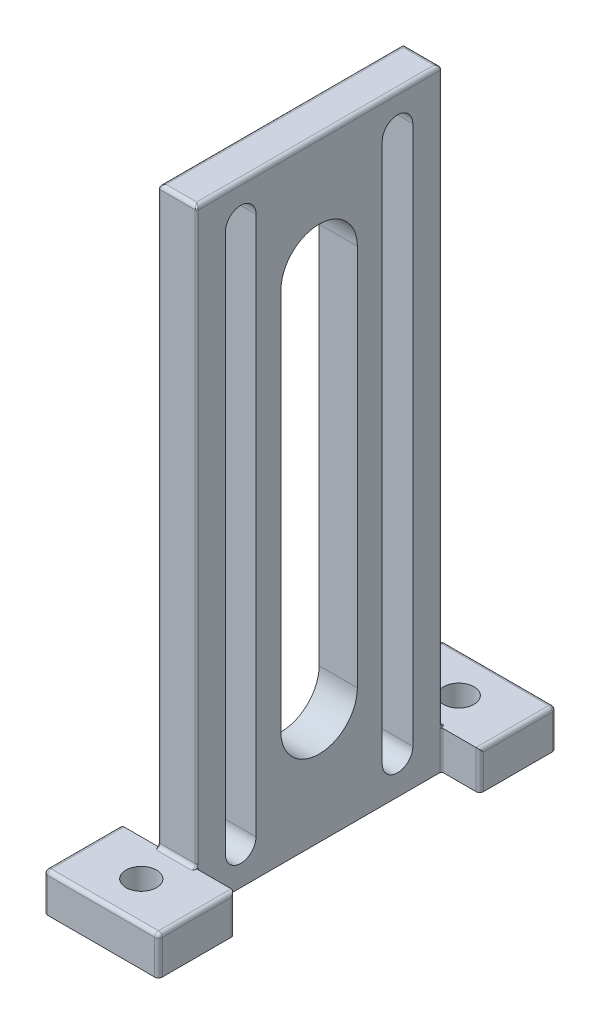
from build123d import *

# Parameters (mm, degrees)
SKETCH1_W             = 32
SKETCH1_H             = 80
BOSS_EXTRUDE1_DEPTH   = 2.5
CUT_EXTRUDE1_REACH    = 45.37
CUT_EXTRUDE2_REACH    = 45.37
SKETCH4_W             = 10
SKETCH4_H             = 15
BOSS_EXTRUDE2_DEPTH   = 5
FILLET1_R             = 0.5
FILLET2_R             = 0.2
CUT_EXTRUDE3_REACH    = 81.732
SKETCH5_R             = 2
BODY_MOVE_COPY1_ANGLE = 90


with BuildPart() as part:
    # Sketch1 → Boss-Extrude1 (new, symmetric)
    with BuildSketch(Plane.XY):
        Rectangle(SKETCH1_W, SKETCH1_H)
    extrude(amount=BOSS_EXTRUDE1_DEPTH, both=True)

    # Sketch2 → Cut-Extrude1 (cut, up to next)
    with BuildSketch(Plane.XY.offset(2.5), mode=Mode.PRIVATE) as cut_extrude1_sk1:
        with BuildLine():
            Line((-5, 25), (-5, -25))
            ThreePointArc((-5, -25), (0, -30), (5, -25))
            Line((5, -25), (5, 25))
            ThreePointArc((5, 25), (0, 30), (-5, 25))
        make_face()
    cut_extrude1_tool1 = extrude(cut_extrude1_sk1.sketch, amount=-CUT_EXTRUDE1_REACH, mode=Mode.PRIVATE) & part.part
    add(cut_extrude1_tool1.solids().sort_by_distance((0, 0, 2.5))[0], mode=Mode.SUBTRACT)

    # Sketch3 → Cut-Extrude2 (cut, up to next)
    with BuildSketch(Plane.XY.offset(2.5), mode=Mode.PRIVATE) as cut_extrude2_sk1:
        with BuildLine():
            Line((-12.25, 35.25), (-12.25, -35.25))
            ThreePointArc((-12.25, -35.25), (-10.25, -37.25), (-8.25, -35.25))
            Line((-8.25, -35.25), (-8.25, 35.25))
            ThreePointArc((-8.25, 35.25), (-10.25, 37.25), (-12.25, 35.25))
        make_face()
    cut_extrude2_tool1 = extrude(cut_extrude2_sk1.sketch, amount=-CUT_EXTRUDE2_REACH, mode=Mode.PRIVATE) & part.part
    cut_extrude2 = cut_extrude2_tool1.solids().sort_by_distance((-10.25, 0, 2.5))[0]
    add(cut_extrude2, mode=Mode.SUBTRACT)

    # Mirror1: Cut-Extrude2 across plane
    add(cut_extrude2.mirror(Plane(origin=(0, 0, 0), x_dir=(0, 0, 1), z_dir=(1, 0, 0))), mode=Mode.SUBTRACT)

    # Sketch4 → Boss-Extrude2 (add)
    with BuildSketch(Plane(origin=(0, -40, 0), x_dir=(-1, 0, 0), z_dir=(0, -1, 0))):
        with Locations((21, 0)):
            Rectangle(SKETCH4_W, SKETCH4_H)
        with Locations((-21, 0)):
            Rectangle(SKETCH4_W, SKETCH4_H)
    extrude(amount=-BOSS_EXTRUDE2_DEPTH)

    # Fillet1
    fillet1_edges = [part.edges().sort_by_distance(p)[0] for p in [
        (16, 40, 0),
        (0, 40, 2.5),
        (-16, 40, 0),
        (0, 40, -2.5),
        (-16, -37.5, 7.5),
        (16, -37.5, 7.5),
        (16, -37.5, -7.5),
        (-16, -37.5, -7.5),
        (-21, -35, 7.5),
        (-26, -37.5, 7.5),
        (-26, -35, 0),
        (-26, -37.5, -7.5),
        (-21, -35, -7.5),
        (21, -35, 7.5),
        (26, -37.5, 7.5),
        (26, -37.5, -7.5),
        (21, -35, -7.5),
        (26, -35, 0),
        (16, -35, 0),
        (-16, -35, 0),
    ]]
    fillet(fillet1_edges, radius=FILLET1_R)

    # Fillet2
    fillet2_edges = [part.edges().sort_by_distance(p)[0] for p in [
        (16, -37.5, -2.5),
    ]]
    fillet(fillet2_edges, radius=FILLET2_R)
    fillet2_2_edges = [part.edges().sort_by_distance(p)[0] for p in [
        (-16, 2.5, -2.5),
        (-16.146446609, -34.853553391, -2.5),
        (-15.853553391, 39.853553391, -2.353553391),
    ]]
    fillet(fillet2_2_edges, radius=FILLET2_R)
    fillet2_3_edges = [part.edges().sort_by_distance(p)[0] for p in [
        (16, 2.5, -2.5),
        (16.146446609, -34.853553391, -2.5),
        (15.853553391, 39.853553391, -2.353553391),
    ]]
    fillet(fillet2_3_edges, radius=FILLET2_R)
    fillet2_4_edges = [part.edges().sort_by_distance(p)[0] for p in [
        (-16, -37.5, -2.5),
    ]]
    fillet(fillet2_4_edges, radius=FILLET2_R)
    fillet2_5_edges = [part.edges().sort_by_distance(p)[0] for p in [
        (16, -37.5, 2.5),
    ]]
    fillet(fillet2_5_edges, radius=FILLET2_R)
    fillet2_6_edges = [part.edges().sort_by_distance(p)[0] for p in [
        (-16, 2.5, 2.5),
        (-16.146446609, -34.853553391, 2.5),
        (-15.853553391, 39.853553391, 2.353553391),
    ]]
    fillet(fillet2_6_edges, radius=FILLET2_R)
    fillet2_7_edges = [part.edges().sort_by_distance(p)[0] for p in [
        (16, 2.5, 2.5),
        (16.146446609, -34.853553391, 2.5),
        (15.853553391, 39.853553391, 2.353553391),
    ]]
    fillet(fillet2_7_edges, radius=FILLET2_R)
    fillet2_8_edges = [part.edges().sort_by_distance(p)[0] for p in [
        (-16, -37.5, 2.5),
    ]]
    fillet(fillet2_8_edges, radius=FILLET2_R)

    # Sketch5 → Cut-Extrude3 (cut, up to next)
    with BuildSketch(Plane(origin=(0, -35, 0), x_dir=(1, 0, 0), z_dir=(0, 1, 0)), mode=Mode.PRIVATE) as cut_extrude3_sk1:
        with Locations((20.75, 0)):
            Circle(SKETCH5_R)
    cut_extrude3_tool1 = extrude(cut_extrude3_sk1.sketch, amount=-CUT_EXTRUDE3_REACH, mode=Mode.PRIVATE) & part.part
    cut_extrude3 = cut_extrude3_tool1.solids().sort_by_distance((20.75, -35, 0))[0]
    add(cut_extrude3, mode=Mode.SUBTRACT)

    # Mirror2: Cut-Extrude3 across plane
    add(cut_extrude3.mirror(Plane(origin=(0, 0, 0), x_dir=(0, 0, 1), z_dir=(1, 0, 0))), mode=Mode.SUBTRACT)


with BuildPart() as part_1:
    # Body-Move/Copy1: moved
    add(part.part.rotate(Axis((0, 0, 0), (0, 1, 0)), BODY_MOVE_COPY1_ANGLE))


solid = part_1.part
